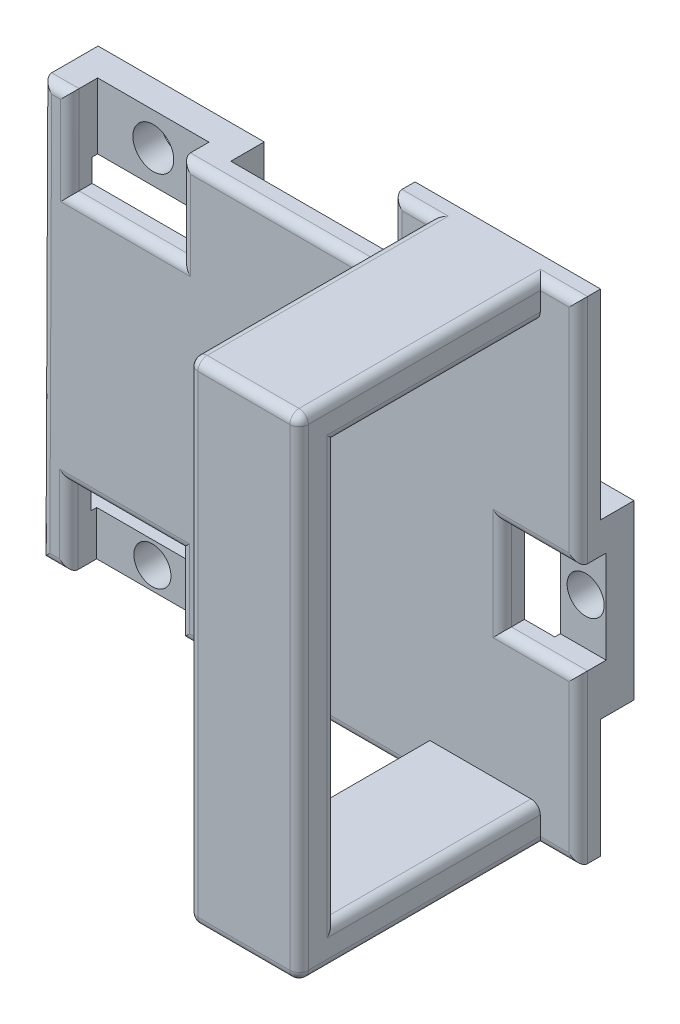
from build123d import *

# Parameters (mm, degrees)
SZKIC1_W                      = 9.053278123
SZKIC1_H                      = 2.4000014
SZKIC1_R                      = 1.00000054
DODANIE_WYCI_GNI_CIE1_DEPTH   = 1.8
SZKIC1_W_2                    = 2.468942166
SZKIC1_H_2                    = 9.307035938
DODANIE_WYCI_GNI_CIE1_2_DEPTH = 1.8
SZKIC1_W_3                    = 8.953699963
SZKIC1_H_3                    = 3.54899108
SZKIC1_R_2                    = 1.10000034
DODANIE_WYCI_GNI_CIE1_3_DEPTH = 1.8
SZKIC2_R                      = 1.00000054
SZKIC2_R_2                    = 1.10000034
DODANIE_WYCI_GNI_CIE2_DEPTH   = 1.2
WYTNIJ_WYCI_GNI_CIE1_START    = -1.5
SZKIC3_W                      = 6
SZKIC3_H                      = 4.77449554
SZKIC3_R                      = 1.10000034
SZKIC3_H_2                    = 4.2000007
SZKIC3_R_2                    = 1.00000054
SZKIC3_W_2                    = 4.104918972
SZKIC3_H_3                    = 5
WYTNIJ_WYCI_GNI_CIE1_DEPTH    = 1.5
SZKIC7_W                      = 10
SZKIC7_H                      = 1.2
DODANIE_WYCI_GNI_CIE3_DEPTH   = 4
SZKIC8_W                      = 5.950377167
SZKIC8_H                      = 2
DODANIE_WYCI_GNI_CIE4_DEPTH   = 11
SZKIC9_W                      = 5.950377167
SZKIC9_H                      = 26.47425658
DODANIE_WYCI_GNI_CIE5_DEPTH   = 2
ZAOKR_GLENIE4_R               = 0.5


with BuildPart() as part:
    # Szkic1 → Dodanie-wyciągnięcie1 (new body)
    with BuildSketch(Plane.XY.offset(158.832884642)):
        with Locations((-14.973320297, -21.27425588)):
            Rectangle(SZKIC1_W, SZKIC1_H)
        with Locations((-14.973320296, -21.27425588)):
            Circle(SZKIC1_R, mode=Mode.SUBTRACT)
    extrude(amount=DODANIE_WYCI_GNI_CIE1_DEPTH)



with BuildPart() as body_2:
    # Szkic1 → Dodanie-wyci_gni_cie1 2 (new body)
    with BuildSketch(Plane.XY.offset(158.832884642)):
        with Locations((8.247126613, -11.430282713)):
            Rectangle(SZKIC1_W_2, SZKIC1_H_2)
        with Locations((8.376678724, -10.97425616)):
            Circle(SZKIC1_R, mode=Mode.SUBTRACT)
    extrude(amount=DODANIE_WYCI_GNI_CIE1_2_DEPTH)


with BuildPart() as body_3:
    # Szkic1 → Dodanie-wyci_gni_cie1 3 (new body)
    with BuildSketch(Plane.XY.offset(158.832884642)):
        with Locations((-14.923531217, -1.77449554)):
            Rectangle(SZKIC1_W_3, SZKIC1_H_3)
        with Locations((-14.923531216, -1.77449554)):
            Circle(SZKIC1_R_2, mode=Mode.SUBTRACT)
    extrude(amount=DODANIE_WYCI_GNI_CIE1_3_DEPTH)


with BuildPart() as part_1:
    add(part.part)

    add(body_2.part)  # Dodanie-wyciągnięcie2 merges body 2

    add(body_3.part)  # Dodanie-wyciągnięcie2 merges body 3
    # Szkic2 → Dodanie-wyciągnięcie2 (add)
    with BuildSketch(Plane.XY.offset(160.632884642)):
        Polygon((9.481597696, 0), (-19.400381198, 0), (-19.499959358, -22.47425658), (9.481597696, -22.47425658), align=None)
        with Locations((8.376678724, -10.97425616)):
            Circle(SZKIC2_R, mode=Mode.SUBTRACT)
        with Locations((-14.973320296, -21.27425588)):
            Circle(SZKIC2_R, mode=Mode.SUBTRACT)
        with Locations((-14.923531216, -1.77449554)):
            Circle(SZKIC2_R_2, mode=Mode.SUBTRACT)
    extrude(amount=DODANIE_WYCI_GNI_CIE2_DEPTH)

    # Szkic3 → Wytnij-wyciągnięcie1 (cut)
    # profile 1 of 3: a face of its own
    with BuildSketch(Plane.XY.offset(161.832884642).offset(WYTNIJ_WYCI_GNI_CIE1_START)):
        with Locations((-14.923531216, -2.38724777)):
            Rectangle(SZKIC3_W, SZKIC3_H)
        with Locations((-14.923531216, -1.77449554)):
            Circle(SZKIC3_R, mode=Mode.SUBTRACT)
    # profile 2 of 3: a face of its own
    with BuildSketch(Plane.XY.offset(161.832884642).offset(WYTNIJ_WYCI_GNI_CIE1_START)):
        with Locations((-14.973320296, -20.37425623)):
            Rectangle(SZKIC3_W, SZKIC3_H_2)
        with Locations((-14.973320296, -21.27425588)):
            Circle(SZKIC3_R_2, mode=Mode.SUBTRACT)
    # profile 3 of 3: a face of its own
    with BuildSketch(Plane.XY.offset(161.832884642).offset(WYTNIJ_WYCI_GNI_CIE1_START)):
        with Locations((7.42913821, -10.97425616)):
            Rectangle(SZKIC3_W_2, SZKIC3_H_3)
        with Locations((8.376678724, -10.97425616)):
            Circle(SZKIC3_R_2, mode=Mode.SUBTRACT)
    extrude(amount=WYTNIJ_WYCI_GNI_CIE1_DEPTH, mode=Mode.SUBTRACT)

    # Szkic7 → Dodanie-wyciągnięcie3 (add)
    with BuildSketch(Plane(origin=(0, 0, 0), x_dir=(1, 0, 0), z_dir=(0, 1, 0))):
        with Locations((4.481597696, -161.232884642)):
            Rectangle(SZKIC7_W, SZKIC7_H)
    extrude(amount=DODANIE_WYCI_GNI_CIE3_DEPTH)

    # Szkic8 → Dodanie-wyciągnięcie4 (add)
    with BuildSketch(Plane.XY.offset(161.832884642)):
        with Locations((4.45678628, 3)):
            Rectangle(SZKIC8_W, SZKIC8_H)
        with Locations((4.45678628, -21.47425658)):
            Rectangle(SZKIC8_W, SZKIC8_H)
    extrude(amount=DODANIE_WYCI_GNI_CIE4_DEPTH)

    # Szkic9 → Dodanie-wyciągnięcie5 (add)
    with BuildSketch(Plane.XY.offset(172.832884642)):
        with Locations((4.45678628, -9.23712829)):
            Rectangle(SZKIC9_W, SZKIC9_H)
    extrude(amount=DODANIE_WYCI_GNI_CIE5_DEPTH)

    # Zaokrąglenie4
    zaokr_glenie4_edges = [part_1.edges().sort_by_distance(p)[0] for p in [
        (0.481597696, 4, 161.832884642),
        (-0.518402304, 2, 161.832884642),
        (-6.22096676, 0, 161.832884642),
        (-11.923531216, -2.38724777, 161.832884642),
        (-14.923531216, -4.77449554, 161.832884642),
        (-17.923531216, -2.38724777, 161.832884642),
        (-18.661956207, 0, 161.832884642),
        (-19.450170278, -11.23712829, 161.832884642),
        (-18.736639827, -22.47425658, 161.832884642),
        (-17.973320296, -20.37425623, 161.832884642),
        (-14.973320296, -18.27425588, 161.832884642),
        (-11.973320296, -20.37425623, 161.832884642),
        (-5.2458613, -22.47425658, 161.832884642),
        (8.456786279, 4, 161.832884642),
        (9.481597696, -2.23712808, 161.832884642),
        (7.42913821, -8.47425616, 161.832884642),
        (5.376678724, -10.97425616, 161.832884642),
        (7.42913821, -13.47425616, 161.832884642),
        (9.481597696, -17.97425637, 161.832884642),
        (8.456786279, -22.47425658, 161.832884642),
        (7.431974863, 4, 168.332884642),
        (7.431974863, 2, 167.332884642),
        (7.431974863, -9.23712829, 172.832884642),
        (7.431974863, -20.47425658, 167.332884642),
        (7.431974863, -9.23712829, 174.832884642),
        (4.456786279, 4, 174.832884642),
        (1.481597696, -9.23712829, 174.832884642),
        (1.481597696, -9.23712829, 172.832884642),
        (1.481597696, 4, 168.332884642),
        (1.481597696, 2, 167.332884642),
        (1.481597696, -22.47425658, 168.332884642),
        (4.456786279, -22.47425658, 174.832884642),
        (7.431974863, -22.47425658, 168.332884642),
    ]]
    fillet(zaokr_glenie4_edges, radius=ZAOKR_GLENIE4_R)


solid = part_1.part
